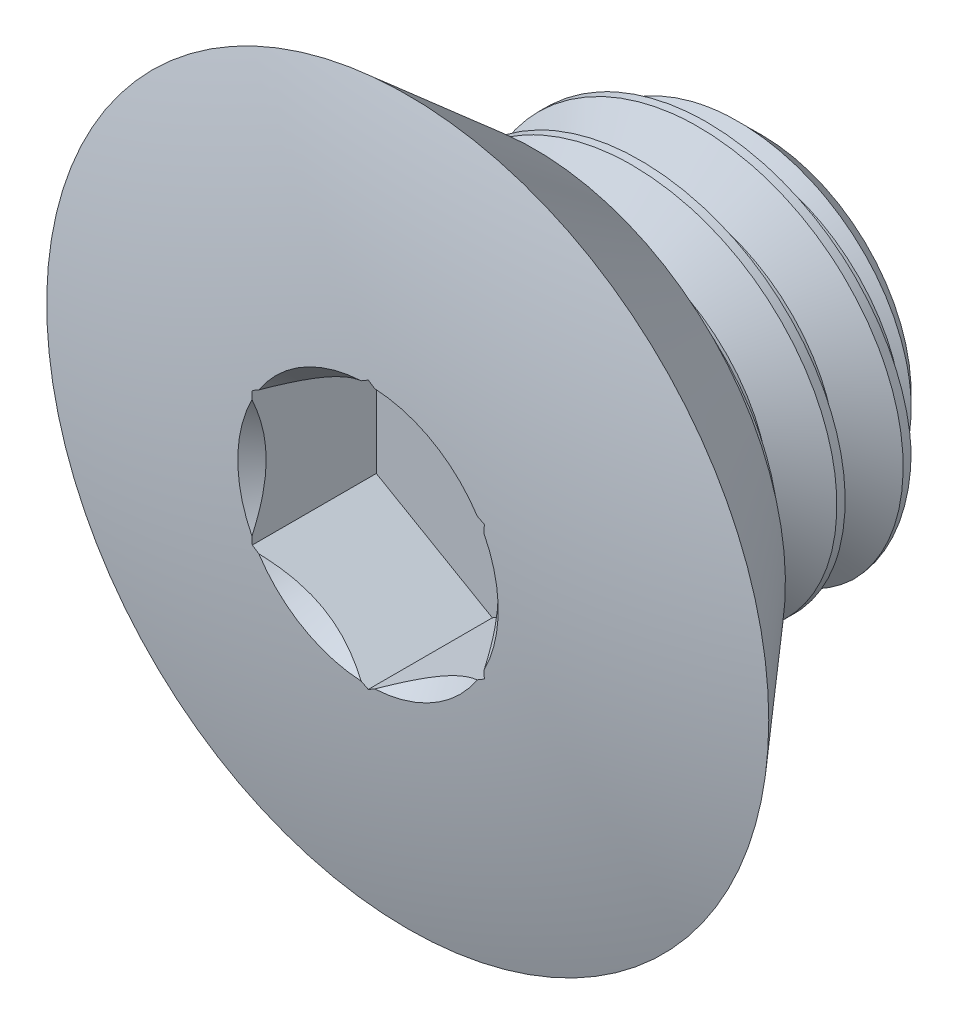
from build123d import *

# Parameters (mm, degrees)
CUT_EXTRUDE1_DEPTH = 3.06705
SKETCH5_R          = 3.207902433
CUT_EXTRUDE2_DEPTH = 3.06705
CUT_EXTRUDE2_TAPER = 45
CUT_SWEEP1_PITCH   = 1.5875
CUT_SWEEP1_TO      = 5.4356


with BuildPart() as part:
    # Sketch2 → Revolve1 (revolve)
    with BuildSketch(Plane(origin=(0, 0, 0), x_dir=(0, 0, -1), z_dir=(1, 0, 0)), mode=Mode.PRIVATE) as revolve1_sk:
        Polygon((-4.7625, 0), (4.7625, 0), (4.7625, 3.571875), (3.571875, 4.7625), (-0.6731, 4.7625), (-0.6731, 5.995396463), (-4.251325, 9.1059), (-4.7625, 9.1059), align=None)
    revolve(revolve1_sk.sketch.rotate(Axis((0, 0, 4.7625), (0, 0, -1)), 180), axis=Axis((0, 0, 4.7625), (0, 0, -1)))

    # Sketch4 → Cut-Extrude1 (cut)
    with BuildSketch(Plane.XY.offset(4.7625)):
        Polygon((2.778125, -1.603951217), (2.778125, 1.603951217), (0, 3.207902433), (-2.778125, 1.603951217), (-2.778125, -1.603951217), (0, -3.207902433), align=None)
    extrude(amount=-CUT_EXTRUDE1_DEPTH, mode=Mode.SUBTRACT)

    # Sketch5 → Cut-Extrude2 (cut)
    with BuildSketch(Plane.XY.offset(4.7625)):
        Circle(SKETCH5_R)
    extrude(amount=-CUT_EXTRUDE2_DEPTH, taper=CUT_EXTRUDE2_TAPER, mode=Mode.SUBTRACT)


with BuildPart() as body_2:
    # Split1: the piece on the far side of the plane
    add(part.part)
    split(bisect_by=Plane.XY.offset(0.6731), keep=Keep.BOTTOM)

    # Cut-Sweep1: arcs per turn and ends read off the stored shape
    # Cut-Sweep1: the profile of Sketch7 screwed along a right-hand helix through 6 turns, 8 arcs to a turn; built about Z, then put on its axis
    cut_sweep1_z = Axis((0, 0, 0), (0, 0, 1))
    cut_sweep1_corners = [(4.848425958, 0, -0.347265625), (4.848425958, 0, -1.835546875), (3.731388504, 0, -1.190625), (3.731388504, 0, -0.9921875)]
    with BuildLine(mode=Mode.PRIVATE) as cut_sweep1_profile:
        Line(cut_sweep1_corners[0], cut_sweep1_corners[1])
        Line(cut_sweep1_corners[1], cut_sweep1_corners[2])
        Line(cut_sweep1_corners[2], cut_sweep1_corners[3])
        Line(cut_sweep1_corners[3], cut_sweep1_corners[0])
    cut_sweep1_cap = Face(cut_sweep1_profile.wire())
    cut_sweep1_turn_angles = [0, 22.5, 45, 67.5, 90, 112.5, 135, 157.5, 180, 202.5, 225, 247.5, 270, 292.5, 315, 337.5, 360]
    cut_sweep1_turn_weights = [1, 0.9238795325112867, 1, 0.9238795325112867, 1, 0.9238795325112867, 1, 0.9238795325112867, 1, 0.9238795325112867, 1, 0.9238795325112867, 1, 0.9238795325112867, 1, 0.9238795325112867, 1]
    cut_sweep1_turn_rails = [Edge.make_bspline([Vector(p[0], p[1], 0).rotate(cut_sweep1_z, cut_sweep1_turn_angles[k]) / cut_sweep1_turn_weights[k] + Vector(0, 0, p[2] + CUT_SWEEP1_PITCH * cut_sweep1_turn_angles[k] / 360) for k in range(17)], [0, 0, 0, 1, 1, 2, 2, 3, 3, 4, 4, 5, 5, 6, 6, 7, 7, 8, 8, 8], 2, cut_sweep1_turn_weights) for p in cut_sweep1_corners]
    cut_sweep1_turn_sides = [Face.make_surface_from_curves(cut_sweep1_turn_rails[p[0]], cut_sweep1_turn_rails[p[1]]) for p in [(0, 1), (1, 2), (2, 3), (3, 0)]]
    cut_sweep1 = Plane(origin=(0, 0, -4.7625), x_dir=(1, 0, 0), z_dir=(0, 0, 1)) * split(Solid(Shell([*[p.moved(Location((0, 0, CUT_SWEEP1_PITCH * i))) for i in range(6) for p in cut_sweep1_turn_sides], cut_sweep1_cap, cut_sweep1_cap.rotate(cut_sweep1_z, 2160).moved(Location((0, 0, CUT_SWEEP1_PITCH * 2160 / 360)))])), bisect_by=Plane.XY.offset(CUT_SWEEP1_TO), keep=Keep.BOTTOM, mode=Mode.PRIVATE)
    add(cut_sweep1, mode=Mode.SUBTRACT)


with BuildPart() as part_1:
    add(part.part)

    # Split1
    split(bisect_by=Plane.XY.offset(0.6731), keep=Keep.TOP)

    add(body_2.part)  # Boss-Extrude1 merges body 2
    # Boss-Extrude1: read off the stored shape, not the designer's step
    # Boss-Extrude1 outline → Boss-Extrude1 (revolve)
    with BuildSketch(Plane.XZ):
        Polygon((3.73138226, 0.6731), (3.73138226, -0.555302799), (4.7625, 0.6731), align=None)
    revolve(axis=Axis((0, 0, 0), (0, 0, 1)))

    # Cut-Revolve3: read off the stored shape, not the designer's step
    # Cut-Revolve3 outline → Cut-Revolve3 (revolve, cut)
    with BuildSketch(Plane.XZ):
        with BuildLine():
            Line((9.1059, 3.7211), (9.1059, 4.7625))
            Line((9.1059, 4.7625), (3.11807481, 4.7625))
            Line((3.11807481, 4.7625), (3.11807481, 4.672672512))
            ThreePointArc((3.11807481, 4.672672512), (5.903726898, 4.325817896), (8.644982439, 3.7211))
            Line((8.644982439, 3.7211), (9.1059, 3.7211))
        make_face()
    revolve(axis=Axis((0, 0, 0), (0, 0, 1)), mode=Mode.SUBTRACT)


solid = part_1.part
